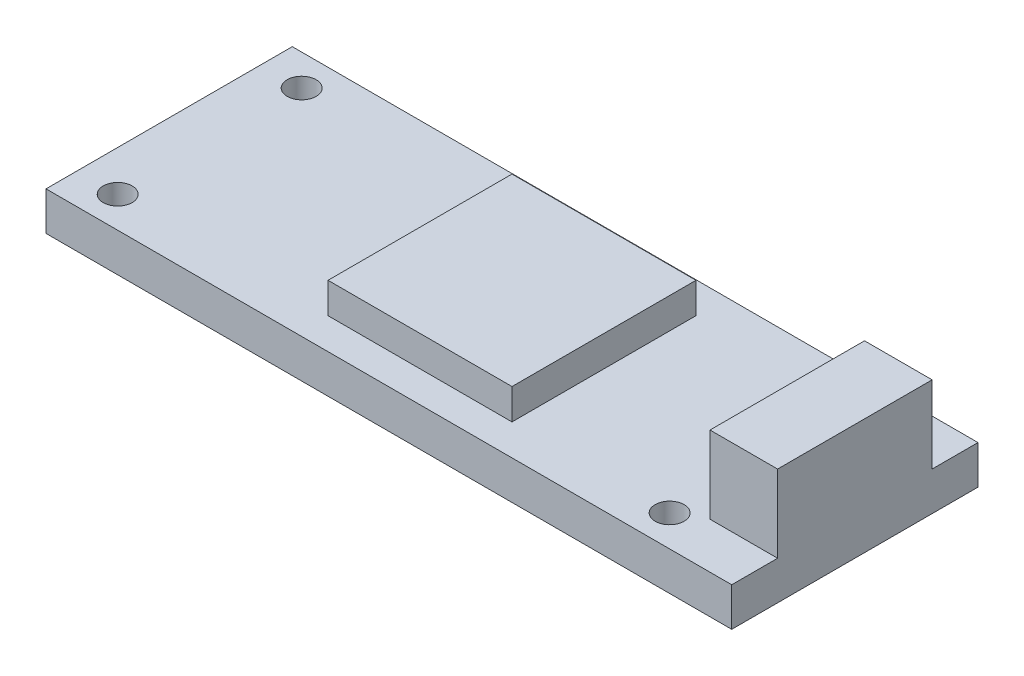
from build123d import *

# Parameters (mm, degrees)
SKETCH1_W           = 71
SKETCH1_H           = 25.5
BOSS_EXTRUDE2_DEPTH = 4
SKETCH4_W           = 7
SKETCH4_H           = 16
BOSS_EXTRUDE3_DEPTH = 8
SKETCH5_W           = 19.05
SKETCH5_H           = 19.05
BOSS_EXTRUDE4_DEPTH = 3.174
SKETCH6_R           = 1.5
CUT_EXTRUDE1_DEPTH  = 39.55920772


with BuildPart() as part:
    # Sketch1 → Boss-Extrude2 (new body)
    with BuildSketch(Plane(origin=(0, 0, 0), x_dir=(1, 0, 0), z_dir=(0, 1, 0))):
        Rectangle(SKETCH1_W, SKETCH1_H)
    extrude(amount=BOSS_EXTRUDE2_DEPTH)

    # Sketch4 → Boss-Extrude3 (add)
    with BuildSketch(Plane(origin=(0, 4, 0), x_dir=(1, 0, 0), z_dir=(0, 1, 0))):
        with Locations((32, 0)):
            Rectangle(SKETCH4_W, SKETCH4_H)
    extrude(amount=BOSS_EXTRUDE3_DEPTH)

    # Sketch5 → Boss-Extrude4 (add)
    with BuildSketch(Plane(origin=(0, 4, 0), x_dir=(1, 0, 0), z_dir=(0, 1, 0))):
        Rectangle(SKETCH5_W, SKETCH5_H)
    extrude(amount=BOSS_EXTRUDE4_DEPTH)

    # Sketch6 → Cut-Extrude1 (cut, through all)
    with BuildSketch(Plane(origin=(0, 4, 0), x_dir=(1, 0, 0), z_dir=(0, 1, 0))):
        with Locations((-31.302, 9.525)):
            Circle(SKETCH6_R)
        with Locations((-31.302, -9.525)):
            Circle(SKETCH6_R)
        with Locations((25.848, 9.525)):
            Circle(SKETCH6_R)
        with Locations((25.848, -9.525)):
            Circle(SKETCH6_R)
    extrude(amount=-CUT_EXTRUDE1_DEPTH, mode=Mode.SUBTRACT)


solid = part.part
